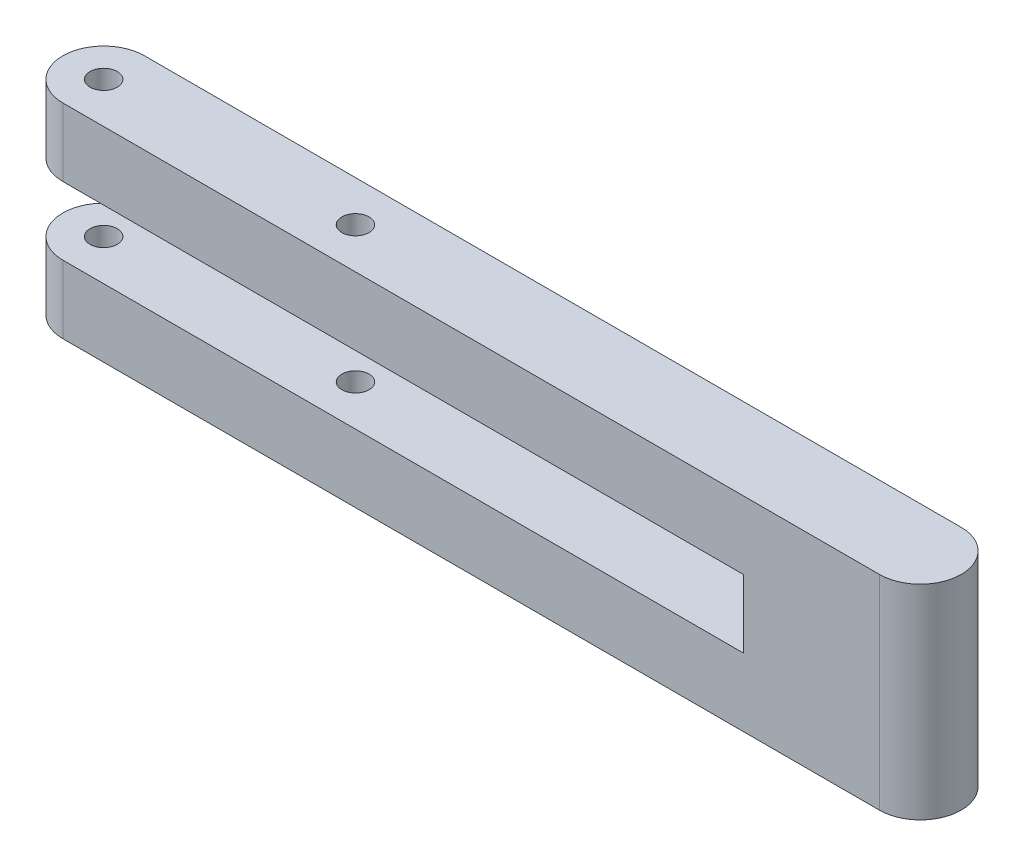
from build123d import *

# Parameters (mm, degrees)
BOSS_EXTRUDE1_DEPTH     = 38.1
SKETCH4_R               = 2.54
CUT_EXTRUDE3_DEPTH      = 105.047031673
CUT_EXTRUDE4_DEPTH      = 6.35
CUT_EXTRUDE4_DEPTH_BACK = 6.35


with BuildPart() as part:
    # Sketch3 → Boss-Extrude1 (new body)
    with BuildSketch(Plane(origin=(0, 0, 0), x_dir=(1, 0, 0), z_dir=(0, 1, 0))):
        with BuildLine():
            Line((-63.5, 7.62), (88.9, 7.62))
            ThreePointArc((88.9, 7.62), (96.52, 0), (88.9, -7.62))
            Line((88.9, -7.62), (-63.5, -7.62))
            ThreePointArc((-63.5, -7.62), (-71.12, 0), (-63.5, 7.62))
        make_face()
    extrude(amount=BOSS_EXTRUDE1_DEPTH)

    # Sketch4 → Cut-Extrude3 (cut, through all)
    with BuildSketch(Plane(origin=(0, 38.1, 0), x_dir=(1, 0, 0), z_dir=(0, 1, 0))):
        with Locations((-63.5, 0)):
            Circle(SKETCH4_R)
        with Locations((-16.51, 0)):
            Circle(SKETCH4_R)
    extrude(amount=-CUT_EXTRUDE3_DEPTH, mode=Mode.SUBTRACT)

    # Sketch5 → Cut-Extrude4 (cut, two sides: drawn at the far end of the back side and taken through both)
    with BuildSketch(Plane(origin=(0, 19.05, 0), x_dir=(1, 0, 0), z_dir=(0, 1, 0)).offset(-CUT_EXTRUDE4_DEPTH_BACK)):
        with BuildLine():
            Line((31.75, 7.62), (-63.5, 7.62))
            ThreePointArc((-63.5, 7.62), (-71.12, 0), (-63.5, -7.62))
            Line((-63.5, -7.62), (0, -7.62))
            Line((0, -7.62), (63.5, -7.62))
            Line((63.5, -7.62), (63.5, 7.62))
            Line((63.5, 7.62), (31.75, 7.62))
        make_face()
    extrude(amount=CUT_EXTRUDE4_DEPTH + CUT_EXTRUDE4_DEPTH_BACK, mode=Mode.SUBTRACT)


solid = part.part
